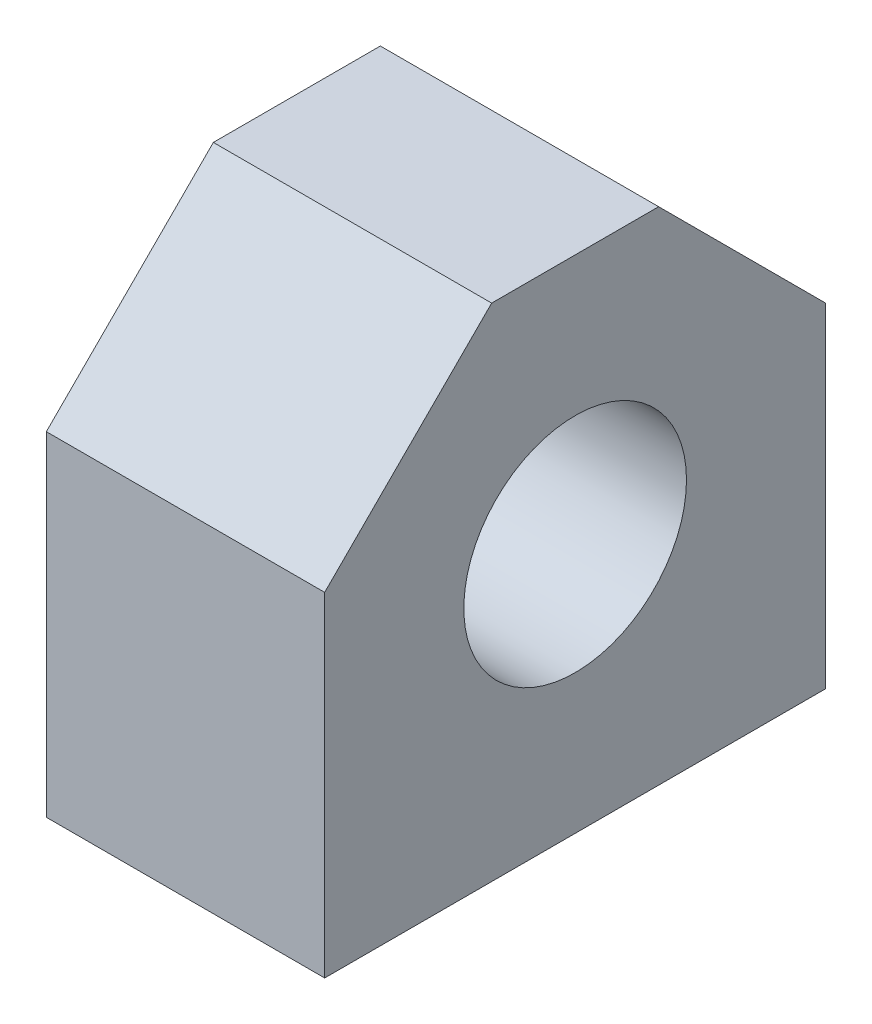
from build123d import *

# Parameters (mm, degrees)
SKETCH2_W           = 57.15
SKETCH2_H           = 57.15
BOSS_EXTRUDE2_DEPTH = 31.75
SKETCH3_R           = 12.7
CUT_EXTRUDE1_DEPTH  = 87.834944003
CUT_EXTRUDE2_DEPTH  = 2.54
FILLET1_R           = 3.175
CHAMFER1_SIZE       = 19.05


with BuildPart() as part:
    # Sketch2 → Boss-Extrude2 (new body)
    with BuildSketch(Plane(origin=(0, 0, 0), x_dir=(0, 0, -1), z_dir=(1, 0, 0))):
        with Locations((28.575, 28.575)):
            Rectangle(SKETCH2_W, SKETCH2_H)
    extrude(amount=BOSS_EXTRUDE2_DEPTH)

    # Sketch3 → Cut-Extrude1 (cut, through all)
    with BuildSketch(Plane(origin=(31.75, 0, 0), x_dir=(0, 0, -1), z_dir=(1, 0, 0))):
        with Locations((28.575, 28.575)):
            Circle(SKETCH3_R)
    extrude(amount=-CUT_EXTRUDE1_DEPTH, mode=Mode.SUBTRACT)

    # Sketch4 → Cut-Extrude2 (cut)
    with BuildSketch(Plane.ZY):
        with BuildLine():
            Line((-35.494752073, 42.8625), (-21.655247927, 42.8625))
            ThreePointArc((-21.655247927, 42.8625), (-12.7, 28.575), (-21.655247927, 14.2875))
            Line((-21.655247927, 14.2875), (-35.494752073, 14.2875))
            ThreePointArc((-35.494752073, 14.2875), (-44.45, 28.575), (-35.494752073, 42.8625))
        make_face()
    extrude(amount=-CUT_EXTRUDE2_DEPTH, mode=Mode.SUBTRACT)

    # Fillet1
    fillet1_edges = [part.edges().sort_by_distance(p)[0] for p in [
        (1.27, 14.2875, -35.494752073),
        (1.27, 14.2875, -21.655247927),
        (1.27, 42.8625, -21.655247927),
        (1.27, 42.8625, -35.494752073),
    ]]
    fillet(fillet1_edges, radius=FILLET1_R)

    # Chamfer1
    chamfer1_edges = [part.edges().sort_by_distance(p)[0] for p in [
        (15.875, 57.15, -57.15),
        (15.875, 57.15, 0),
    ]]
    chamfer(chamfer1_edges, length=CHAMFER1_SIZE)


solid = part.part
